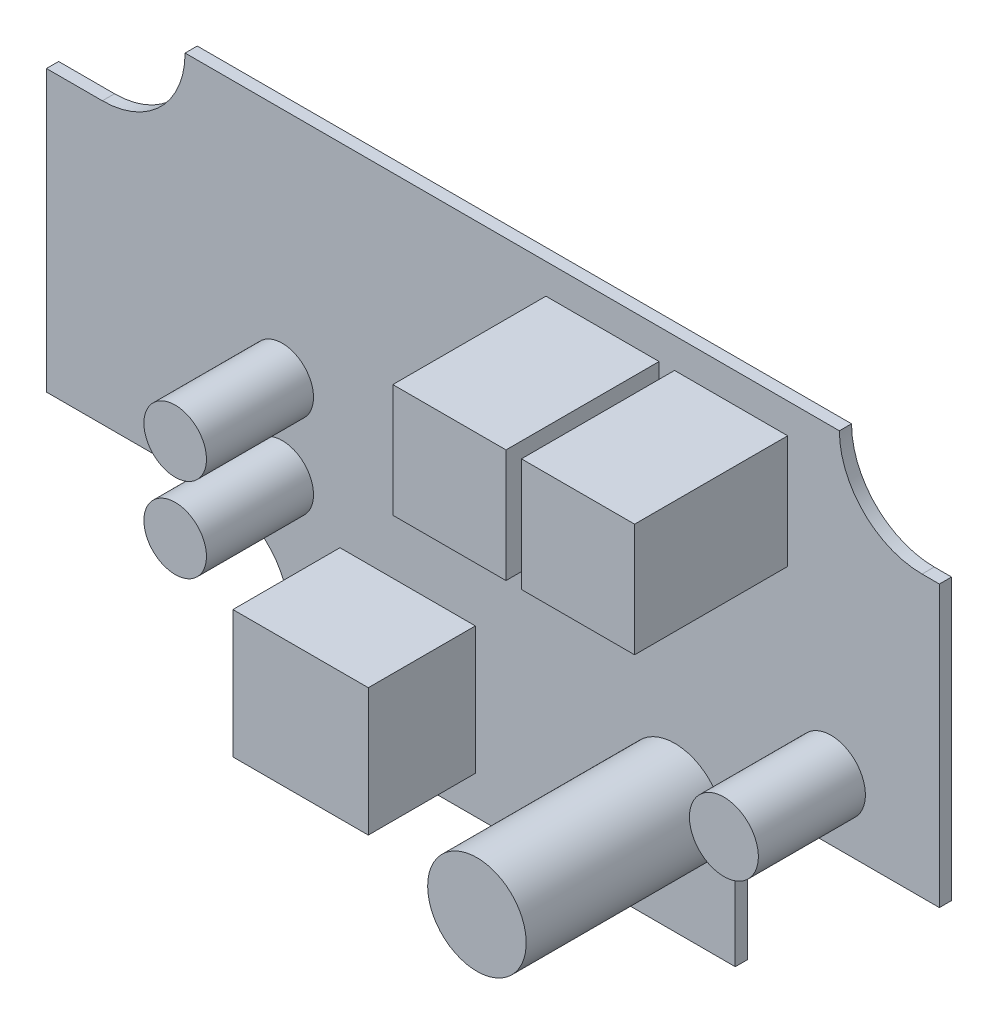
from build123d import *

# Parameters (mm, degrees)
BOSS_EXTRUDE1_DEPTH = 1.5748
SKETCH2_W           = 14.65
SKETCH2_H           = 14.65
BOSS_EXTRUDE2_DEPTH = 19.82
SKETCH3_R           = 6.38
BOSS_EXTRUDE3_DEPTH = 25.62
SKETCH4_R           = 4.05
SKETCH4_R_2         = 4.45846
SKETCH4_W           = 17.528842204
SKETCH4_H           = 16.527194078
BOSS_EXTRUDE4_DEPTH = 13.86


with BuildPart() as part:
    # Sketch1 → Boss-Extrude1 (new body)
    with BuildSketch(Plane.XY):
        with BuildLine():
            Line((28.87285, -26.077881523), (28.87285, -36.536287167))
            Line((28.87285, -36.536287167), (-28.87285, -36.536287167))
            Line((-28.87285, -36.536287167), (-28.87285, -26.077881523))
            ThreePointArc((-28.87285, -26.077881523), (-31.621417538, -19.442252496), (-38.257046565, -16.693684958))
            Line((-38.257046565, -16.693684958), (-60.301272865, -16.693684958))
            Line((-60.301272865, -16.693684958), (-60.301272865, 19.589257803))
            Line((-60.301272865, 19.589257803), (-53.061571168, 19.589257803))
            ThreePointArc((-53.061571168, 19.589257803), (-45.490240762, 22.725405542), (-42.354093023, 30.296735947))
            Line((-42.354093023, 30.296735947), (42.35409485, 30.296735947))
            ThreePointArc((42.35409485, 30.296735947), (45.490242589, 22.725405542), (53.061572995, 19.589257803))
            Line((53.061572995, 19.589257803), (55.30081595, 19.589257803))
            Line((55.30081595, 19.589257803), (55.30081595, -16.693684958))
            Line((55.30081595, -16.693684958), (38.257046565, -16.693684958))
            ThreePointArc((38.257046565, -16.693684958), (31.621417538, -19.442252496), (28.87285, -26.077881523))
        make_face()
    extrude(amount=BOSS_EXTRUDE1_DEPTH)

    # Sketch2 → Boss-Extrude2 (add)
    with BuildSketch(Plane.XY.offset(1.5748)):
        with Locations((11.686894588, 19.066351865)):
            Rectangle(SKETCH2_W, SKETCH2_H)
        with Locations((28.336894588, 19.066351865)):
            Rectangle(SKETCH2_W, SKETCH2_H)
    extrude(amount=BOSS_EXTRUDE2_DEPTH)

    # Sketch3 → Boss-Extrude3 (add)
    with BuildSketch(Plane.XY.offset(1.5748)):
        with Locations((21.050882576, -21.779136192)):
            Circle(SKETCH3_R)
    extrude(amount=BOSS_EXTRUDE3_DEPTH)

    # Sketch4 → Boss-Extrude4 (add)
    with BuildSketch(Plane.XY.offset(1.5748)):
        with Locations((-29.775377187, 0)):
            Circle(SKETCH4_R)
        with Locations((-29.775377187, -10.91000664)):
            Circle(SKETCH4_R)
        with Locations((41.26131402, -8.841126254)):
            Circle(SKETCH4_R_2)
        with Locations((-13.538274313, -23.407391016)):
            Rectangle(SKETCH4_W, SKETCH4_H)
    extrude(amount=BOSS_EXTRUDE4_DEPTH)


solid = part.part
